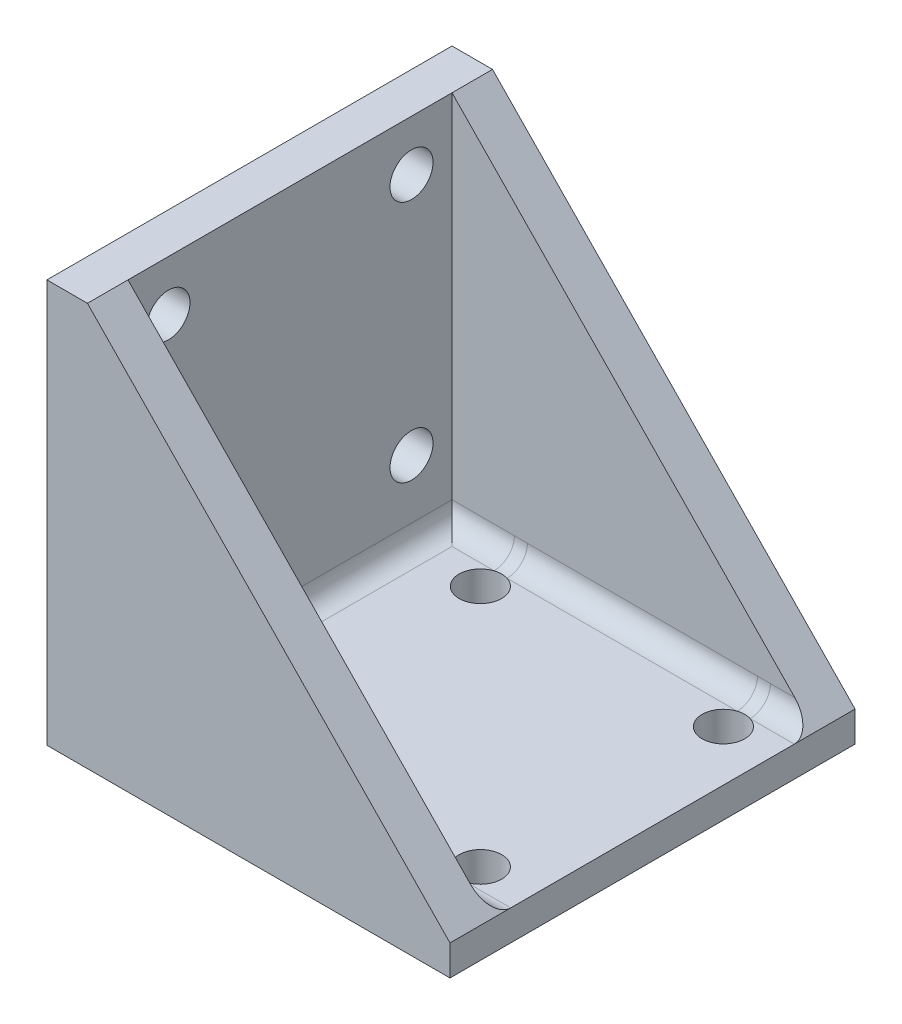
from build123d import *

# Parameters (mm, degrees)
SSS_W               = 39.8
SSS_H               = 40
SSS_R               = 2.1
BOSS_EXTRUDE2_DEPTH = 3
SKETCH1_W           = 40
SKETCH1_H           = 39.8
SKETCH1_R           = 2.125
BOSS_EXTRUDE3_DEPTH = 4
BOSS_EXTRUDE4_DEPTH = 4
FILLET1_R           = 2


with BuildPart() as part:
    # sss → Boss-Extrude2 (new body)
    with BuildSketch(Plane(origin=(0, 0, 0), x_dir=(1, 0, 0), z_dir=(0, 1, 0))):
        with Locations((-0.1, 0)):
            Rectangle(SSS_W, SSS_H)
        with Locations((-9.2, 12)):
            Circle(SSS_R, mode=Mode.SUBTRACT)
        with Locations((14.8, 12)):
            Circle(SSS_R, mode=Mode.SUBTRACT)
        with Locations((14.8, -12)):
            Circle(SSS_R, mode=Mode.SUBTRACT)
        with Locations((-9.2, -12)):
            Circle(SSS_R, mode=Mode.SUBTRACT)
    extrude(amount=BOSS_EXTRUDE2_DEPTH)

    # Sketch1 → Boss-Extrude3 (add)
    with BuildSketch(Plane.ZY.offset(20)):
        with Locations((0, 19.9)):
            Rectangle(SKETCH1_W, SKETCH1_H)
        with Locations((-12, 34.8)):
            Circle(SKETCH1_R, mode=Mode.SUBTRACT)
        with Locations((12, 34.8)):
            Circle(SKETCH1_R, mode=Mode.SUBTRACT)
        with Locations((12, 10.8)):
            Circle(SKETCH1_R, mode=Mode.SUBTRACT)
        with Locations((-12, 10.8)):
            Circle(SKETCH1_R, mode=Mode.SUBTRACT)
    extrude(amount=-BOSS_EXTRUDE3_DEPTH)

    # Sketch2 → Boss-Extrude4 (add)
    with BuildSketch(Plane.XY.offset(20)):
        Polygon((-20, 39.8), (-20, 0), (19.8, 0), (19.8, 3), (-16, 39.8), align=None)
    boss_extrude4 = extrude(amount=-BOSS_EXTRUDE4_DEPTH)

    # Mirror1: Boss-Extrude4 across plane
    add(boss_extrude4.mirror(Plane.XY))

    # Fillet1
    fillet1_edges = [part.edges().sort_by_distance(p)[0] for p in [
        (1.9, 3, -16),
        (1.9, 3, 16),
        (-16, 3, 0),
    ]]
    fillet(fillet1_edges, radius=FILLET1_R)


solid = part.part
